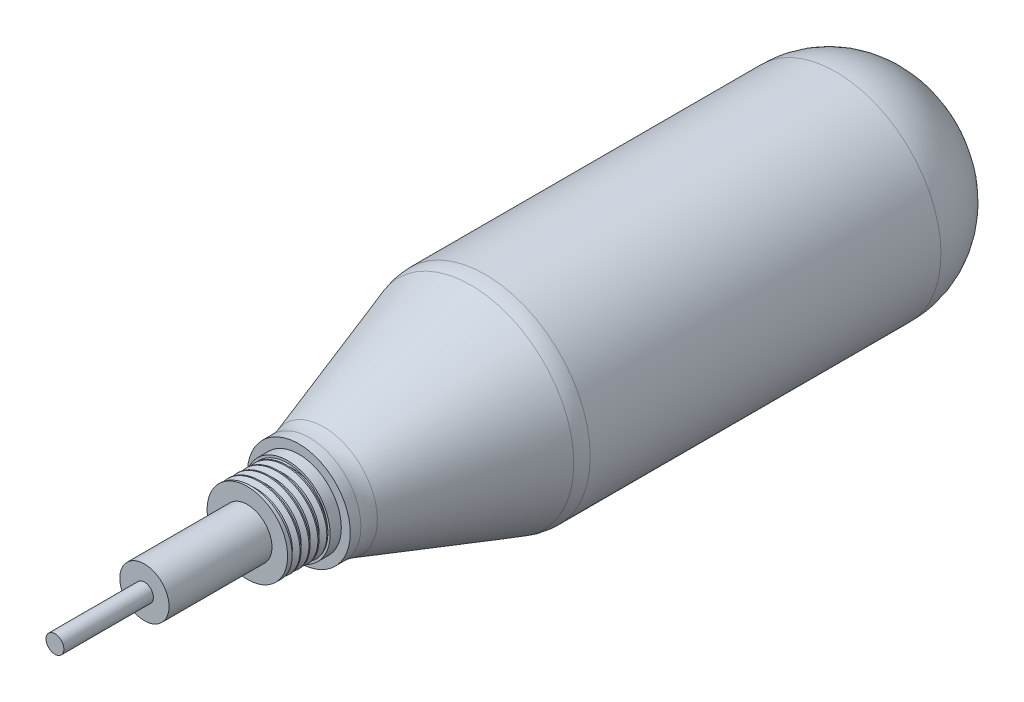
from build123d import *

# Parameters (mm, degrees)
FILETAGE1_PITCH = 2


with BuildPart() as part:
    # Esquisse2 → Révolution1 (revolve)
    with BuildSketch(Plane(origin=(0, 0, 0), x_dir=(0, 0, -1), z_dir=(1, 0, 0)), mode=Mode.PRIVATE) as r_volution1_sk:
        with BuildLine():
            Line((0, 0), (151.5, 0))
            Line((151.5, 0), (151.5, 3.5))
            ThreePointArc((151.5, 3.5), (145.642135624, 17.642135624), (131.5, 23.5))
            Line((131.5, 23.5), (53.122776602, 23.5))
            ThreePointArc((53.122776602, 23.5), (51.520954172, 23.370874576), (49.960498942, 22.986832981))
            Line((49.960498942, 22.986832981), (17.039501058, 12.013167019))
            ThreePointArc((17.039501058, 12.013167019), (15.479045828, 11.629125424), (13.877223398, 11.5))
            Line((13.877223398, 11.5), (11.5, 11.5))
            Line((11.5, 11.5), (11.5, 9.5))
            Line((11.5, 9.5), (9, 9.5))
            Line((9, 9.5), (9, 9))
            Line((9, 9), (0, 9))
            Line((0, 9), (0, 5.5))
            Line((0, 5.5), (-23, 5.5))
            Line((-23, 5.5), (-23, 2))
            Line((-23, 2), (-43, 2))
            Line((-43, 2), (-43, 0))
            Line((-43, 0), (-23, 0))
            Line((-23, 0), (0, 0))
        make_face()
    revolve(r_volution1_sk.sketch.rotate(Axis((0, 0, 0), (0, 0, -1)), 90), axis=Axis((0, 0, 0), (0, 0, -1)))

    # Filetage1: the profile of Profil de filetage1 profile screwed along a right-hand helix of 4.5 turns, 10 arcs to a turn; built about Z, then put on its axis
    filetage1_z = Axis((0, 0, 0), (0, 0, 1))
    filetage1_corners = [(9.0003, 0, -0.000173205), (9.0003, 0, 1.7501732), (7.91746825, 0, 1.124999997), (7.91746825, 0, 0.624999997)]
    with BuildLine(mode=Mode.PRIVATE) as filetage1_profile:
        Line(filetage1_corners[0], filetage1_corners[1])
        Line(filetage1_corners[1], filetage1_corners[2])
        Line(filetage1_corners[2], filetage1_corners[3])
        Line(filetage1_corners[3], filetage1_corners[0])
    filetage1_cap = Face(filetage1_profile.wire())
    filetage1_turn_angles = [0, 18, 36, 54, 72, 90, 108, 126, 144, 162, 180, 198, 216, 234, 252, 270, 288, 306, 324, 342, 360]
    filetage1_turn_weights = [1, 0.9510565162951535, 1, 0.9510565162951535, 1, 0.9510565162951535, 1, 0.9510565162951535, 1, 0.9510565162951535, 1, 0.9510565162951535, 1, 0.9510565162951535, 1, 0.9510565162951535, 1, 0.9510565162951535, 1, 0.9510565162951535, 1]
    filetage1_turn_rails = [Edge.make_bspline([Vector(p[0], p[1], 0).rotate(filetage1_z, filetage1_turn_angles[k]) / filetage1_turn_weights[k] + Vector(0, 0, p[2] + FILETAGE1_PITCH * filetage1_turn_angles[k] / 360) for k in range(21)], [0, 0, 0, 1, 1, 2, 2, 3, 3, 4, 4, 5, 5, 6, 6, 7, 7, 8, 8, 9, 9, 10, 10, 10], 2, filetage1_turn_weights) for p in filetage1_corners]
    filetage1_turn_sides = [Face.make_surface_from_curves(filetage1_turn_rails[p[0]], filetage1_turn_rails[p[1]]) for p in [(0, 1), (1, 2), (2, 3), (3, 0)]]
    filetage1_last_angles = [1440, 1458, 1476, 1494, 1512, 1530, 1548, 1566, 1584, 1602, 1620]
    filetage1_last_weights = [1, 0.9510565162951535, 1, 0.9510565162951535, 1, 0.9510565162951535, 1, 0.9510565162951535, 1, 0.9510565162951535, 1]
    filetage1_last_rails = [Edge.make_bspline([Vector(p[0], p[1], 0).rotate(filetage1_z, filetage1_last_angles[k]) / filetage1_last_weights[k] + Vector(0, 0, p[2] + FILETAGE1_PITCH * filetage1_last_angles[k] / 360) for k in range(11)], [0, 0, 0, 1, 1, 2, 2, 3, 3, 4, 4, 5, 5, 5], 2, filetage1_last_weights) for p in filetage1_corners]
    filetage1_last_sides = [Face.make_surface_from_curves(filetage1_last_rails[p[0]], filetage1_last_rails[p[1]]) for p in [(0, 1), (1, 2), (2, 3), (3, 0)]]
    filetage1 = Plane(origin=(0, 0, 0), x_dir=(-1, 0, 0), z_dir=(0, 0, -1)) * Solid(Shell([*[p.moved(Location((0, 0, FILETAGE1_PITCH * i))) for i in range(4) for p in filetage1_turn_sides], *filetage1_last_sides, filetage1_cap, filetage1_cap.rotate(filetage1_z, 1620).moved(Location((0, 0, FILETAGE1_PITCH * 1620 / 360)))]))
    add(filetage1, mode=Mode.SUBTRACT)


solid = part.part
